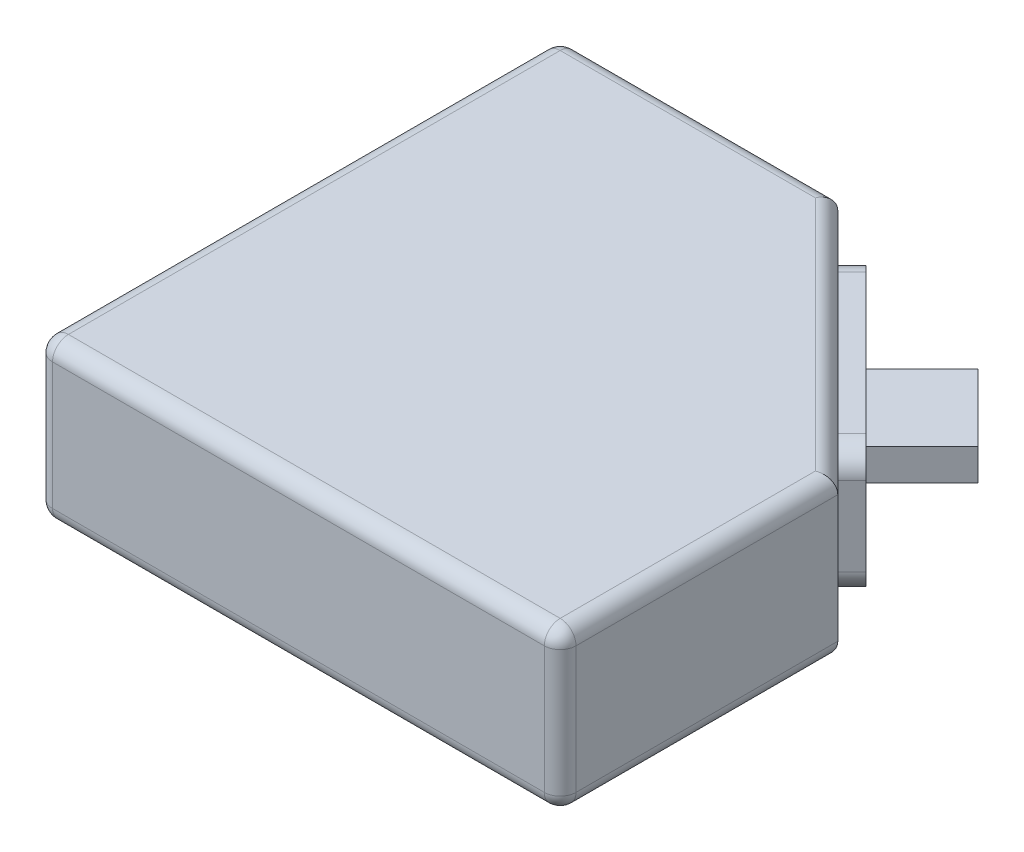
from build123d import *

# Parameters (mm, degrees)
EXTRUDE_1_DEPTH = 20
EXTRUDE_2_DEPTH = 2.5
SKETCH_3_W      = 12
SKETCH_3_H      = 4
EXTRUDE_3_DEPTH = 10
FILLET_1_R      = 2


with BuildPart() as part:
    # 草图1 → 凸台-拉伸1 (new body)
    with BuildSketch(Plane(origin=(0, 0, 0), x_dir=(1, 0, 0), z_dir=(0, 1, 0))):
        Polygon((35, 66), (66, 35), (66, 0), (0, 0), (0, 66), align=None)
    extrude(amount=EXTRUDE_1_DEPTH)

    # 草图2 → 凸台-拉伸2 (add)
    with BuildSketch(Plane(origin=(50.5, 0, -50.5), x_dir=(-0.7071067811865475, 0, -0.7071067811865477), z_dir=(0.7071067811865477, 0, -0.7071067811865475))):
        with BuildLine():
            Line((15.5, 15), (15.5, 5))
            ThreePointArc((15.5, 5), (14.621320344, 2.878679656), (12.5, 2))
            Line((12.5, 2), (-12.5, 2))
            ThreePointArc((-12.5, 2), (-14.621320344, 2.878679656), (-15.5, 5))
            Line((-15.5, 5), (-15.5, 15))
            ThreePointArc((-15.5, 15), (-14.621320344, 17.121320344), (-12.5, 18))
            Line((-12.5, 18), (12.5, 18))
            ThreePointArc((12.5, 18), (14.621320344, 17.121320344), (15.5, 15))
        make_face()
    extrude(amount=EXTRUDE_2_DEPTH)

    # 草图3 → 凸台-拉伸3 (add)
    with BuildSketch(Plane(origin=(52.267766953, 0, -52.267766953), x_dir=(-0.7071067811865476, 0, -0.7071067811865476), z_dir=(0.7071067811865476, 0, -0.7071067811865476))):
        with Locations((0, 10)):
            Rectangle(SKETCH_3_W, SKETCH_3_H)
    extrude(amount=EXTRUDE_3_DEPTH)

    # 圆角1
    fillet_1_edges = [part.edges().sort_by_distance(p)[0] for p in [
        (66, 20, -17.5),
        (50.5, 20, -50.5),
        (17.5, 20, -66),
        (0, 20, -33),
        (17.5, 0, -66),
        (50.5, 0, -50.5),
        (66, 0, -17.5),
        (33, 0, 0),
        (0, 0, -33),
        (33, 20, 0),
        (0, 10, -66),
        (66, 10, 0),
        (0, 10, 0),
    ]]
    fillet(fillet_1_edges, radius=FILLET_1_R - 0.0001)  # a hair under: the kernel refuses the full size


solid = part.part
